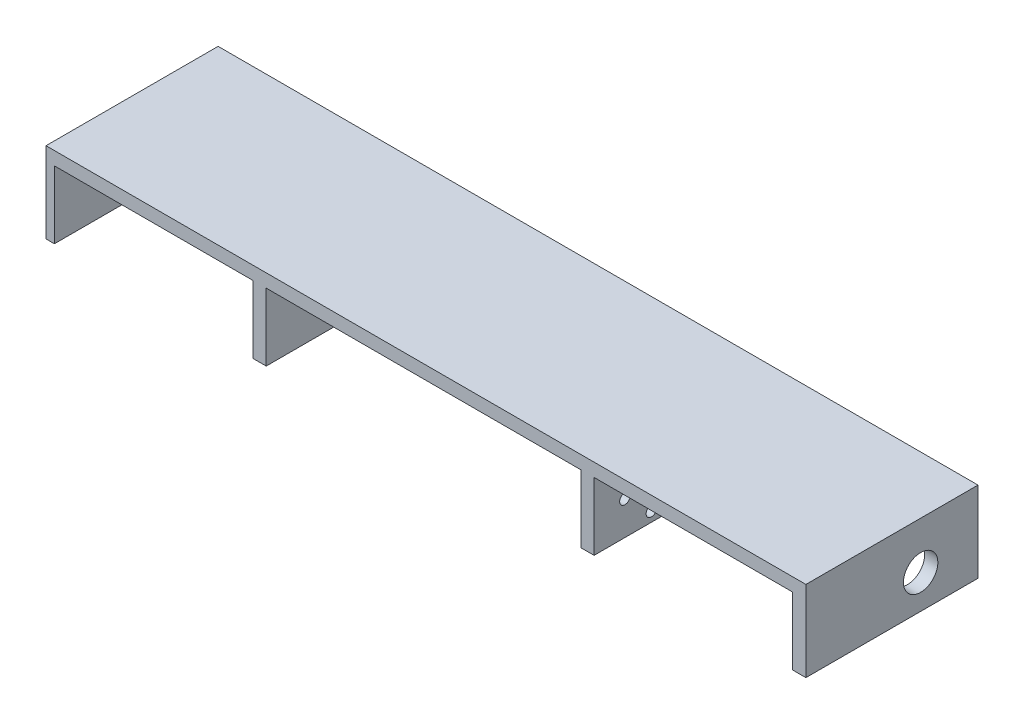
from build123d import *

# Parameters (mm, degrees)
SKETCH2_W           = 287
SKETCH2_H           = 65
BOSS_EXTRUDE1_DEPTH = 5
SKETCH4_W           = 3.175
SKETCH4_H           = 65
BOSS_EXTRUDE2_DEPTH = 25.5
SKETCH5_W           = 5
SKETCH5_H           = 65
BOSS_EXTRUDE3_DEPTH = 25.5
SKETCH6_W           = 5
SKETCH6_H           = 65
BOSS_EXTRUDE4_DEPTH = 25.5
SKETCH8_W           = 5
SKETCH8_H           = 65
BOSS_EXTRUDE5_DEPTH = 25.5
CUT_EXTRUDE1_REACH  = 299.556
SKETCH7_R           = 3.5
CUT_EXTRUDE2_REACH  = 299.556
SKETCH9_R           = 6.5
CUT_EXTRUDE3_REACH  = 223.403
SKETCH11_R          = 4.5
CUT_EXTRUDE4_REACH  = 225.111
SKETCH10_R          = 4.5
SKETCH14_W          = 1
SKETCH14_H          = 25.5
BOSS_EXTRUDE6_DEPTH = 1
CUT_EXTRUDE6_REACH  = 218.736
SKETCH15_R          = 2


with BuildPart() as part:
    # Sketch2 → Boss-Extrude1 (new body)
    with BuildSketch(Plane(origin=(0, 0, 0), x_dir=(1, 0, 0), z_dir=(0, 1, 0))):
        with Locations((100.827281974, 41.798134807)):
            Rectangle(SKETCH2_W, SKETCH2_H)
    extrude(amount=BOSS_EXTRUDE1_DEPTH)

    # Sketch4 → Boss-Extrude2 (add)
    with BuildSketch(Plane.XZ):
        with Locations((-41.085218026, -41.798134807)):
            Rectangle(SKETCH4_W, SKETCH4_H)
    extrude(amount=BOSS_EXTRUDE2_DEPTH)

    # Sketch5 → Boss-Extrude3 (add)
    with BuildSketch(Plane.XZ):
        with Locations((38.002281974, -41.798134807)):
            Rectangle(SKETCH5_W, SKETCH5_H)
    extrude(amount=BOSS_EXTRUDE3_DEPTH)

    # Sketch6 → Boss-Extrude4 (add)
    with BuildSketch(Plane.XZ):
        with Locations((241.827281974, -41.798134807)):
            Rectangle(SKETCH6_W, SKETCH6_H)
    extrude(amount=BOSS_EXTRUDE4_DEPTH)

    # Sketch8 → Boss-Extrude5 (add)
    with BuildSketch(Plane.XZ):
        with Locations((161.827281974, -41.798134807)):
            Rectangle(SKETCH8_W, SKETCH8_H)
    extrude(amount=BOSS_EXTRUDE5_DEPTH)

    # Sketch7 → Cut-Extrude1 (cut, up to next)
    with BuildSketch(Plane.ZY.offset(42.672718026), mode=Mode.PRIVATE) as cut_extrude1_sk1:
        with Locations((-30.964801474, -12.75)):
            Circle(SKETCH7_R)
    cut_extrude1_tool1 = extrude(cut_extrude1_sk1.sketch, amount=-CUT_EXTRUDE1_REACH, mode=Mode.PRIVATE) & part.part
    add(cut_extrude1_tool1.solids().sort_by_distance((-42.672718, -12.75, -30.964801))[0], mode=Mode.SUBTRACT)

    # Sketch9 → Cut-Extrude2 (cut, up to next)
    with BuildSketch(Plane(origin=(244.327281974, 0, 0), x_dir=(0, 0, -1), z_dir=(1, 0, 0)), mode=Mode.PRIVATE) as cut_extrude2_sk1:
        with Locations((52.631468141, -12.75)):
            Circle(SKETCH9_R)
    cut_extrude2_tool1 = extrude(cut_extrude2_sk1.sketch, amount=-CUT_EXTRUDE2_REACH, mode=Mode.PRIVATE) & part.part
    add(cut_extrude2_tool1.solids().sort_by_distance((244.327282, -12.75, -52.631468))[0], mode=Mode.SUBTRACT)

    # Sketch11 → Cut-Extrude3 (cut, up to next)
    with BuildSketch(Plane(origin=(164.327281974, 0, 0), x_dir=(0, 0, -1), z_dir=(1, 0, 0)), mode=Mode.PRIVATE) as cut_extrude3_sk1:
        with Locations((52.631468141, -12.75)):
            Circle(SKETCH11_R)
    cut_extrude3_tool1 = extrude(cut_extrude3_sk1.sketch, amount=-CUT_EXTRUDE3_REACH, mode=Mode.PRIVATE) & part.part
    add(cut_extrude3_tool1.solids().sort_by_distance((164.327282, -12.75, -52.631468))[0], mode=Mode.SUBTRACT)

    # Sketch10 → Cut-Extrude4 (cut, up to next)
    with BuildSketch(Plane.ZY.offset(-35.502281974), mode=Mode.PRIVATE) as cut_extrude4_sk1:
        with Locations((-30.964801474, -12.75)):
            Circle(SKETCH10_R)
    cut_extrude4_tool1 = extrude(cut_extrude4_sk1.sketch, amount=-CUT_EXTRUDE4_REACH, mode=Mode.PRIVATE) & part.part
    add(cut_extrude4_tool1.solids().sort_by_distance((35.502282, -12.75, -30.964801))[0], mode=Mode.SUBTRACT)

    # Sketch14 → Boss-Extrude6 (add)
    with BuildSketch(Plane.ZY.offset(-159.327281974)):
        with Locations((-15.468134807, -12.75)):
            Rectangle(SKETCH14_W, SKETCH14_H)
        with Locations((-46.468134807, -12.75)):
            Rectangle(SKETCH14_W, SKETCH14_H)
    extrude(amount=BOSS_EXTRUDE6_DEPTH)

    # Sketch15 → Cut-Extrude6 (cut, up to next)
    with BuildSketch(Plane.ZY.offset(-159.327281974), mode=Mode.PRIVATE) as cut_extrude6_sk1:
        with Locations((-20.968134807, -12.75)):
            Circle(SKETCH15_R)
    cut_extrude6_tool1 = extrude(cut_extrude6_sk1.sketch, amount=-CUT_EXTRUDE6_REACH, mode=Mode.PRIVATE) & part.part
    # Sketch15 → Cut-Extrude6 (cut, up to next)
    with BuildSketch(Plane.ZY.offset(-159.327281974), mode=Mode.PRIVATE) as cut_extrude6_sk2:
        with Locations((-40.968134807, -12.75)):
            Circle(SKETCH15_R)
    cut_extrude6_tool2 = extrude(cut_extrude6_sk2.sketch, amount=-CUT_EXTRUDE6_REACH, mode=Mode.PRIVATE) & part.part
    # Sketch15 → Cut-Extrude6 (cut, up to next)
    with BuildSketch(Plane.ZY.offset(-159.327281974), mode=Mode.PRIVATE) as cut_extrude6_sk3:
        with Locations((-30.968134807, -21.75)):
            Circle(SKETCH15_R)
    cut_extrude6_tool3 = extrude(cut_extrude6_sk3.sketch, amount=-CUT_EXTRUDE6_REACH, mode=Mode.PRIVATE) & part.part
    # Sketch15 → Cut-Extrude6 (cut, up to next)
    with BuildSketch(Plane.ZY.offset(-159.327281974), mode=Mode.PRIVATE) as cut_extrude6_sk4:
        with Locations((-30.968134807, -3.75)):
            Circle(SKETCH15_R)
    cut_extrude6_tool4 = extrude(cut_extrude6_sk4.sketch, amount=-CUT_EXTRUDE6_REACH, mode=Mode.PRIVATE) & part.part
    add(cut_extrude6_tool1.solids().sort_by_distance((159.327282, -12.75, -20.968135))[0], mode=Mode.SUBTRACT)
    add(cut_extrude6_tool2.solids().sort_by_distance((159.327282, -12.75, -40.968135))[0], mode=Mode.SUBTRACT)
    add(cut_extrude6_tool3.solids().sort_by_distance((159.327282, -21.75, -30.968135))[0], mode=Mode.SUBTRACT)
    add(cut_extrude6_tool4.solids().sort_by_distance((159.327282, -3.75, -30.968135))[0], mode=Mode.SUBTRACT)


solid = part.part
